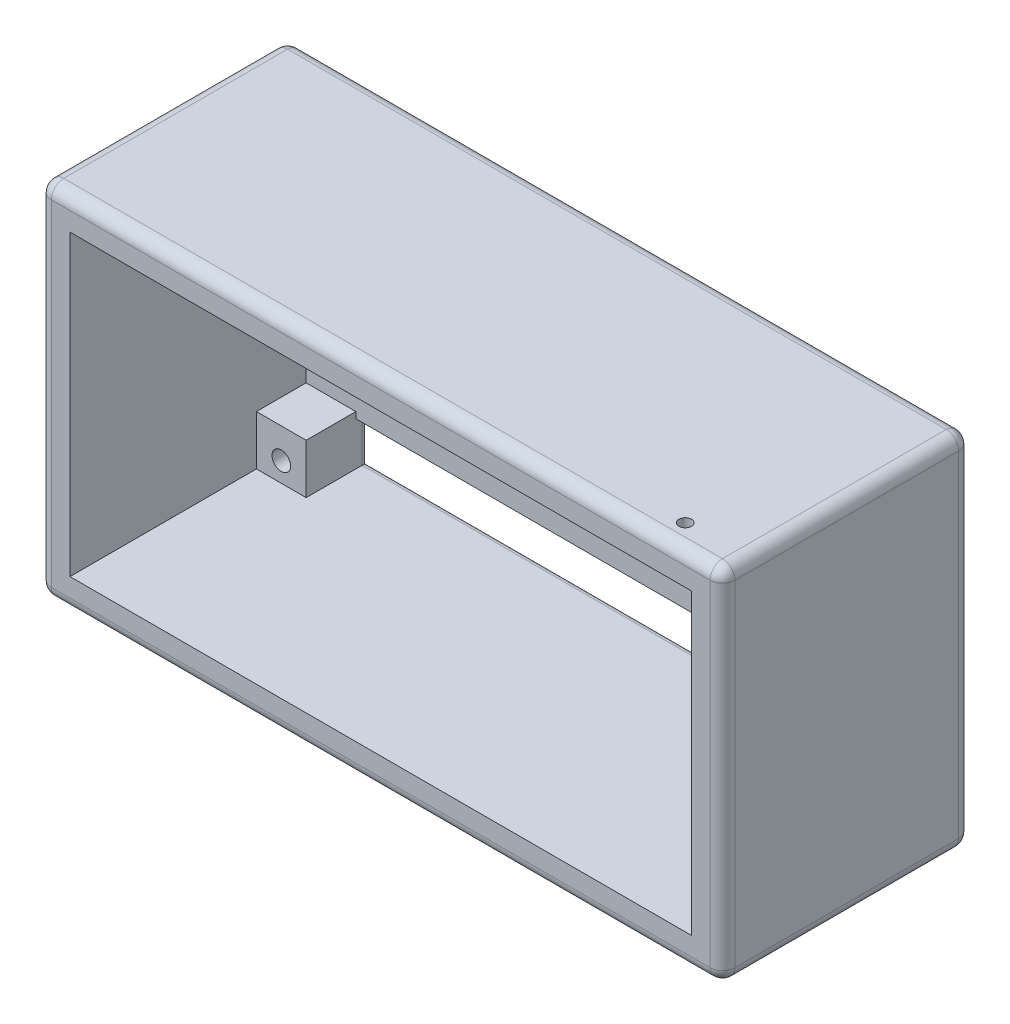
from build123d import *

# Parameters (mm, degrees)
SKETCH_1_W               = 110
SKETCH_1_H               = 58
EXTRUDE_1_DEPTH          = 40
SKETCH_1_4_R             = 9.5
SKETCH_1_4_W             = 84
SKETCH_1_4_H             = 7
CUT_EXTRUDE_1_DEPTH      = 2
SKETCH_2_OUTSIDE_W       = 138.126
SKETCH_2_OUTSIDE_H       = 86.126
SKETCH_2_OUTSIDE_W_2     = 110
SKETCH_2_OUTSIDE_H_2     = 58
SKETCH_2_OUTSIDE_W_3     = 100
SKETCH_2_OUTSIDE_H_3     = 48
CUT_EXTRUDE_4_DEPTH      = 30
CUT_EXTRUDE_5_REACH      = 132.629
SKETCH_3_R               = 1
CUT_EXTRUDE_8_DEPTH      = 8
CUT_EXTRUDE_9_DEPTH      = 128.921851144
CUT_EXTRUDE_9_DEPTH_BACK = 128.921851144
SKETCH_5_3_R             = 1.5
FILLET_1_R               = 2
FILLET_3_R               = 1


with BuildPart() as part:
    # Эскиз1 → Бобышка-Вытянуть1 (new body)
    with BuildSketch(Plane.XY):
        with Locations((55, 29)):
            Rectangle(SKETCH_1_W, SKETCH_1_H)
    extrude(amount=EXTRUDE_1_DEPTH)

    # Эскиз1<4> → Вырез-Вытянуть1 (cut)
    with BuildSketch(Plane.XY):
        with Locations((20.2, 29.6)):
            Circle(SKETCH_1_4_R)
        with Locations((89.7, 29.6)):
            Circle(SKETCH_1_4_R)
        with Locations((69.2, 29.6)):
            Circle(SKETCH_1_4_R)
        with Locations((40.8, 29.6)):
            Circle(SKETCH_1_4_R)
        with Locations((55, 8.5)):
            Rectangle(SKETCH_1_4_W, SKETCH_1_4_H)
    extrude(amount=CUT_EXTRUDE_1_DEPTH, mode=Mode.SUBTRACT)

    # Эскиз2 outside → Вырез-Вытянуть4 (cut)
    # profile 1 of 2: a face of its own
    with BuildSketch(Plane.XY.offset(40)):
        with Locations((55, 29)):
            Rectangle(SKETCH_2_OUTSIDE_W, SKETCH_2_OUTSIDE_H)
        with Locations((55, 29)):
            Rectangle(SKETCH_2_OUTSIDE_W_2, SKETCH_2_OUTSIDE_H_2, mode=Mode.SUBTRACT)
    # profile 2 of 2: a face of its own
    with BuildSketch(Plane.XY.offset(40)):
        with Locations((55, 29)):
            Rectangle(SKETCH_2_OUTSIDE_W_3, SKETCH_2_OUTSIDE_H_3)
    extrude(amount=-CUT_EXTRUDE_4_DEPTH, mode=Mode.SUBTRACT)

    # Эскиз3 → Вырез-Вытянуть5 (cut, up to next)
    with BuildSketch(Plane(origin=(0, 58, 0), x_dir=(1, 0, 0), z_dir=(0, 1, 0)), mode=Mode.PRIVATE) as cut_extrude_5_sk1:
        with Locations(Location((100, -36, 0), (0, 0, 180))):
            Circle(SKETCH_3_R)
    cut_extrude_5_tool1 = extrude(cut_extrude_5_sk1.sketch, amount=-CUT_EXTRUDE_5_REACH, mode=Mode.PRIVATE) & part.part
    add(cut_extrude_5_tool1.solids().sort_by_distance((100, 58, 36))[0], mode=Mode.SUBTRACT)

    # Эскиз5 → Вырез-Вытянуть8 (cut)
    with BuildSketch(Plane.XY.offset(10)):
        Polygon((97, 53), (13, 53), (13, 45), (5, 45), (5, 13), (13, 13), (13, 5), (97, 5), (97, 13), (105, 13), (105, 45), (97, 45), align=None)
    extrude(amount=-CUT_EXTRUDE_8_DEPTH, mode=Mode.SUBTRACT)

    # Эскиз5<3> → Вырез-Вытянуть9 (cut, two sides: drawn at the far end of the back side and taken through both)
    with BuildSketch(Plane.XY.offset(10).offset(-CUT_EXTRUDE_9_DEPTH_BACK)):
        with Locations((9, 8.15)):
            Circle(SKETCH_5_3_R)
        with Locations((101, 49.85)):
            Circle(SKETCH_5_3_R)
        with Locations((9, 49.85)):
            Circle(SKETCH_5_3_R)
        with Locations((101, 8.15)):
            Circle(SKETCH_5_3_R)
    extrude(amount=CUT_EXTRUDE_9_DEPTH + CUT_EXTRUDE_9_DEPTH_BACK, mode=Mode.SUBTRACT)

    # Скругление1
    fillet_1_edges = [part.edges().sort_by_distance(p)[0] for p in [
        (55, 58, 40),
        (0, 29, 40),
        (55, 0, 40),
        (110, 29, 40),
        (55, 0, 0),
        (0, 29, 0),
        (55, 58, 0),
        (110, 29, 0),
        (110, 0, 20),
        (0, 0, 20),
        (0, 58, 20),
        (110, 58, 20),
    ]]
    fillet(fillet_1_edges, radius=FILLET_1_R)

    # Скругление3
    # the kernel refuses this fillet: 1 mm, written as the material it takes off along each edge
    with BuildSketch(Plane(origin=(40.8, 29.6, 0), x_dir=(1, 0, 0), z_dir=(0, -1, 0))) as fillet_3_piece_1:
        with BuildLine():
            CenterArc((9.5 + FILLET_3_R, FILLET_3_R), FILLET_3_R, 180, 90)
            Line((9.5, FILLET_3_R), (9.5, 0))
            Line((9.5, 0), (9.5 + FILLET_3_R, 0))
        make_face()
    revolve(axis=Axis((40.8, 29.6, 0), (0, 0, 1)), mode=Mode.SUBTRACT)
    with BuildSketch(Plane(origin=(69.2, 29.6, 0), x_dir=(1, 0, 0), z_dir=(0, -1, 0))) as fillet_3_piece_2:
        with BuildLine():
            CenterArc((9.5 + FILLET_3_R, FILLET_3_R), FILLET_3_R, 180, 90)
            Line((9.5, FILLET_3_R), (9.5, 0))
            Line((9.5, 0), (9.5 + FILLET_3_R, 0))
        make_face()
    revolve(axis=Axis((69.2, 29.6, 0), (0, 0, 1)), mode=Mode.SUBTRACT)
    with BuildSketch(Plane(origin=(89.7, 29.6, 0), x_dir=(1, 0, 0), z_dir=(0, -1, 0))) as fillet_3_piece_3:
        with BuildLine():
            CenterArc((9.5 + FILLET_3_R, FILLET_3_R), FILLET_3_R, 180, 90)
            Line((9.5, FILLET_3_R), (9.5, 0))
            Line((9.5, 0), (9.5 + FILLET_3_R, 0))
        make_face()
    revolve(axis=Axis((89.7, 29.6, 0), (0, 0, 1)), mode=Mode.SUBTRACT)
    with BuildSketch(Plane(origin=(13, 5, 0), x_dir=(-1, 0, 0), z_dir=(0, 1, 0)), Plane(origin=(97, 12, 0), x_dir=(1, 0, 0), z_dir=(0, -1, 0))) as fillet_3_piece_4:
        with BuildLine():
            CenterArc((FILLET_3_R, FILLET_3_R), FILLET_3_R, 180, 90)
            Line((0, FILLET_3_R), (0, 0))
            Line((0, 0), (FILLET_3_R, 0))
        make_face()
    extrude(amount=7, mode=Mode.SUBTRACT)
    with BuildSketch(Plane(origin=(97, 5, 0), x_dir=(0, -1, 0), z_dir=(-1, 0, 0)), Plane(origin=(13, 12, 0), x_dir=(0, 1, 0), z_dir=(1, 0, 0))) as fillet_3_piece_5:
        with BuildLine():
            CenterArc((FILLET_3_R, FILLET_3_R), FILLET_3_R, 180, 90)
            Line((0, FILLET_3_R), (0, 0))
            Line((0, 0), (FILLET_3_R, 0))
        make_face()
    extrude(amount=84, mode=Mode.SUBTRACT)
    with BuildSketch(Plane(origin=(20.2, 29.6, 0), x_dir=(1, 0, 0), z_dir=(0, -1, 0))) as fillet_3_piece_6:
        with BuildLine():
            CenterArc((9.5 + FILLET_3_R, FILLET_3_R), FILLET_3_R, 180, 90)
            Line((9.5, FILLET_3_R), (9.5, 0))
            Line((9.5, 0), (9.5 + FILLET_3_R, 0))
        make_face()
    revolve(axis=Axis((20.2, 29.6, 0), (0, 0, 1)), mode=Mode.SUBTRACT)
    with BuildSketch(Plane(origin=(13, 2.5, 0), x_dir=(-1, 0, 0), z_dir=(0, 1, 0))) as fillet_3_piece_7a_section:
        with BuildLine():
            CenterArc((FILLET_3_R, FILLET_3_R), FILLET_3_R, 180, 90)
            Line((0, FILLET_3_R), (0, 0))
            Line((0, 0), (FILLET_3_R, 0))
        make_face()
    fillet_3_piece_7a = extrude(amount=9.5, mode=Mode.PRIVATE)
    fillet_3_piece_7a = split(fillet_3_piece_7a, bisect_by=Plane(origin=(12.773604886, 5, 0.226395114), z_dir=(0, -1, 0)), keep=Keep.TOP, mode=Mode.PRIVATE)
    with BuildSketch(Plane(origin=(97, 5, 0), x_dir=(0, -1, 0), z_dir=(-1, 0, 0))) as fillet_3_piece_7b_section:
        with BuildLine():
            CenterArc((FILLET_3_R, FILLET_3_R), FILLET_3_R, 180, 90)
            Line((0, FILLET_3_R), (0, 0))
            Line((0, 0), (FILLET_3_R, 0))
        make_face()
    fillet_3_piece_7b = extrude(amount=86.5, mode=Mode.PRIVATE)
    fillet_3_piece_7b = split(fillet_3_piece_7b, bisect_by=Plane(origin=(13, 4.773604886, 0.226395114), z_dir=(-1, 0, 0)), keep=Keep.TOP, mode=Mode.PRIVATE)
    fillet_3_piece_7 = fillet_3_piece_7a & fillet_3_piece_7b
    add(fillet_3_piece_7, mode=Mode.SUBTRACT)
    with BuildSketch(Plane(origin=(10.5, 12, 0), x_dir=(0, 1, 0), z_dir=(1, 0, 0))) as fillet_3_piece_8a_section:
        with BuildLine():
            CenterArc((FILLET_3_R, FILLET_3_R), FILLET_3_R, 180, 90)
            Line((0, FILLET_3_R), (0, 0))
            Line((0, 0), (FILLET_3_R, 0))
        make_face()
    fillet_3_piece_8a = extrude(amount=86.5, mode=Mode.PRIVATE)
    fillet_3_piece_8a = split(fillet_3_piece_8a, bisect_by=Plane(origin=(13, 12.226395114, 0.226395114), z_dir=(-1, 0, 0)), keep=Keep.TOP, mode=Mode.PRIVATE)
    with BuildSketch(Plane(origin=(13, 5, 0), x_dir=(-1, 0, 0), z_dir=(0, 1, 0))) as fillet_3_piece_8b_section:
        with BuildLine():
            CenterArc((FILLET_3_R, FILLET_3_R), FILLET_3_R, 180, 90)
            Line((0, FILLET_3_R), (0, 0))
            Line((0, 0), (FILLET_3_R, 0))
        make_face()
    fillet_3_piece_8b = extrude(amount=9.5, mode=Mode.PRIVATE)
    fillet_3_piece_8b = split(fillet_3_piece_8b, bisect_by=Plane(origin=(12.773604886, 12, 0.226395114), z_dir=(0, 1, 0)), keep=Keep.TOP, mode=Mode.PRIVATE)
    fillet_3_piece_8 = fillet_3_piece_8a & fillet_3_piece_8b
    add(fillet_3_piece_8, mode=Mode.SUBTRACT)
    with BuildSketch(Plane(origin=(97, 12, 0), x_dir=(1, 0, 0), z_dir=(0, -1, 0))) as fillet_3_piece_9a_section:
        with BuildLine():
            CenterArc((FILLET_3_R, FILLET_3_R), FILLET_3_R, 180, 90)
            Line((0, FILLET_3_R), (0, 0))
            Line((0, 0), (FILLET_3_R, 0))
        make_face()
    fillet_3_piece_9a = extrude(amount=9.5, mode=Mode.PRIVATE)
    fillet_3_piece_9a = split(fillet_3_piece_9a, bisect_by=Plane(origin=(97.226395114, 5, 0.226395114), z_dir=(0, -1, 0)), keep=Keep.TOP, mode=Mode.PRIVATE)
    with BuildSketch(Plane(origin=(99.5, 5, 0), x_dir=(0, -1, 0), z_dir=(-1, 0, 0))) as fillet_3_piece_9b_section:
        with BuildLine():
            CenterArc((FILLET_3_R, FILLET_3_R), FILLET_3_R, 180, 90)
            Line((0, FILLET_3_R), (0, 0))
            Line((0, 0), (FILLET_3_R, 0))
        make_face()
    fillet_3_piece_9b = extrude(amount=86.5, mode=Mode.PRIVATE)
    fillet_3_piece_9b = split(fillet_3_piece_9b, bisect_by=Plane(origin=(97, 4.773604886, 0.226395114), z_dir=(1, 0, 0)), keep=Keep.TOP, mode=Mode.PRIVATE)
    fillet_3_piece_9 = fillet_3_piece_9a & fillet_3_piece_9b
    add(fillet_3_piece_9, mode=Mode.SUBTRACT)
    with BuildSketch(Plane(origin=(13, 12, 0), x_dir=(0, 1, 0), z_dir=(1, 0, 0))) as fillet_3_piece_10a_section:
        with BuildLine():
            CenterArc((FILLET_3_R, FILLET_3_R), FILLET_3_R, 180, 90)
            Line((0, FILLET_3_R), (0, 0))
            Line((0, 0), (FILLET_3_R, 0))
        make_face()
    fillet_3_piece_10a = extrude(amount=86.5, mode=Mode.PRIVATE)
    fillet_3_piece_10a = split(fillet_3_piece_10a, bisect_by=Plane(origin=(97, 12.226395114, 0.226395114), z_dir=(1, 0, 0)), keep=Keep.TOP, mode=Mode.PRIVATE)
    with BuildSketch(Plane(origin=(97, 14.5, 0), x_dir=(1, 0, 0), z_dir=(0, -1, 0))) as fillet_3_piece_10b_section:
        with BuildLine():
            CenterArc((FILLET_3_R, FILLET_3_R), FILLET_3_R, 180, 90)
            Line((0, FILLET_3_R), (0, 0))
            Line((0, 0), (FILLET_3_R, 0))
        make_face()
    fillet_3_piece_10b = extrude(amount=9.5, mode=Mode.PRIVATE)
    fillet_3_piece_10b = split(fillet_3_piece_10b, bisect_by=Plane(origin=(97.226395114, 12, 0.226395114), z_dir=(0, 1, 0)), keep=Keep.TOP, mode=Mode.PRIVATE)
    fillet_3_piece_10 = fillet_3_piece_10a & fillet_3_piece_10b
    add(fillet_3_piece_10, mode=Mode.SUBTRACT)


solid = part.part
